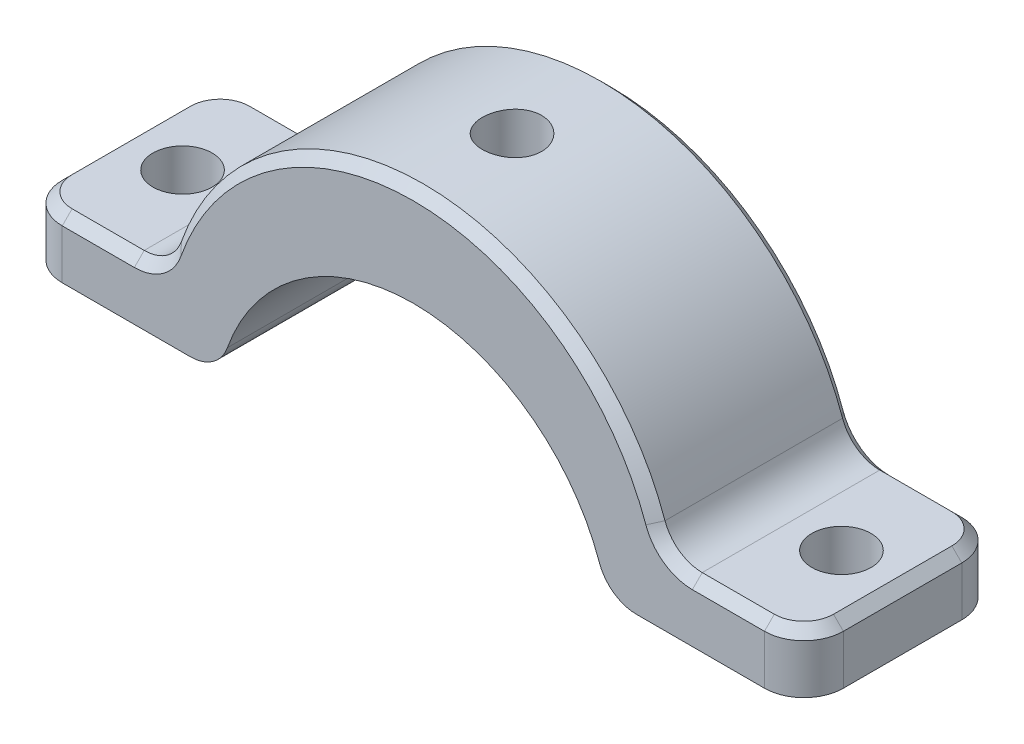
from build123d import *

# Parameters (mm, degrees)
EXTRUDE_1_DEPTH     = 10
FILLET_1_R          = 2
CHAMFER_1_SIZE      = 0.5
SKETCH_2_R          = 1.5
CUT_EXTRUDE_1_DEPTH = 25.330211249
SKETCH_3_R          = 1.5
CUT_EXTRUDE_2_DEPTH = 26.709126384


with BuildPart() as part:
    # 草图1 → 凸台-拉伸1 (new body)
    with BuildSketch(Plane.XY):
        with BuildLine():
            Line((-19.797958971, 0), (-19.797958971, 3))
            Line((-19.797958971, 3), (-14.142135624, 3))
            ThreePointArc((-14.142135624, 3), (-12.987435085, 3.367006838), (-12.256517541, 4.333333333))
            ThreePointArc((-12.256517541, 4.333333333), (0, 13), (12.256517541, 4.333333333))
            ThreePointArc((12.256517541, 4.333333333), (12.987435085, 3.367006838), (14.142135624, 3))
            Line((14.142135624, 3), (19.797958971, 3))
            Line((19.797958971, 3), (19.797958971, 0))
            Line((19.797958971, 0), (11.313708499, 0))
            ThreePointArc((11.313708499, 0), (10.159007961, 0.367006838), (9.428090416, 1.333333333))
            ThreePointArc((9.428090416, 1.333333333), (0, 8), (-9.428090416, 1.333333333))
            ThreePointArc((-9.428090416, 1.333333333), (-10.159007961, 0.367006838), (-11.313708499, 0))
            Line((-11.313708499, 0), (-19.797958971, 0))
        make_face()
    extrude(amount=EXTRUDE_1_DEPTH)

    # 圆角1
    fillet_1_edges = [part.edges().sort_by_distance(p)[0] for p in [
        (-19.797958971, 1.5, 0),
        (-19.797958971, 1.5, 10),
        (19.797958971, 1.5, 10),
        (19.797958971, 1.5, 0),
    ]]
    fillet(fillet_1_edges, radius=FILLET_1_R)

    # 倒角1
    chamfer_1_edges = [part.edges().sort_by_distance(p)[0] for p in [
        (15.970047297, 3, 10),
        (19.212172534, 3, 9.414213562),
        (12.987435085, 3.367006838, 10),
        (19.797958971, 3, 5),
        (0, 13, 10),
        (19.212172534, 3, 0.585786438),
        (-12.987435085, 3.367006838, 10),
        (15.970047297, 3, 0),
        (-15.970047297, 3, 10),
        (12.987435085, 3.367006838, 0),
        (-19.212172534, 3, 9.414213562),
        (0, 13, 0),
        (-19.797958971, 3, 5),
        (-12.987435085, 3.367006838, 0),
        (-19.212172534, 3, 0.585786438),
        (-15.970047297, 3, 0),
    ]]
    chamfer(chamfer_1_edges, length=CHAMFER_1_SIZE)

    # 草图2 → 切除-拉伸1 (cut, through all)
    with BuildSketch(Plane(origin=(0, 3, 0), x_dir=(1, 0, 0), z_dir=(0, 1, 0))):
        with Locations((-16.7, -5)):
            Circle(SKETCH_2_R)
        with Locations((16.7, -5)):
            Circle(SKETCH_2_R)
    extrude(amount=-CUT_EXTRUDE_1_DEPTH, mode=Mode.SUBTRACT)

    # 草图3 → 切除-拉伸2 (cut, through all)
    with BuildSketch(Plane.XZ):
        with Locations((0, 5)):
            Circle(SKETCH_3_R)
    extrude(amount=-CUT_EXTRUDE_2_DEPTH, mode=Mode.SUBTRACT)


solid = part.part
